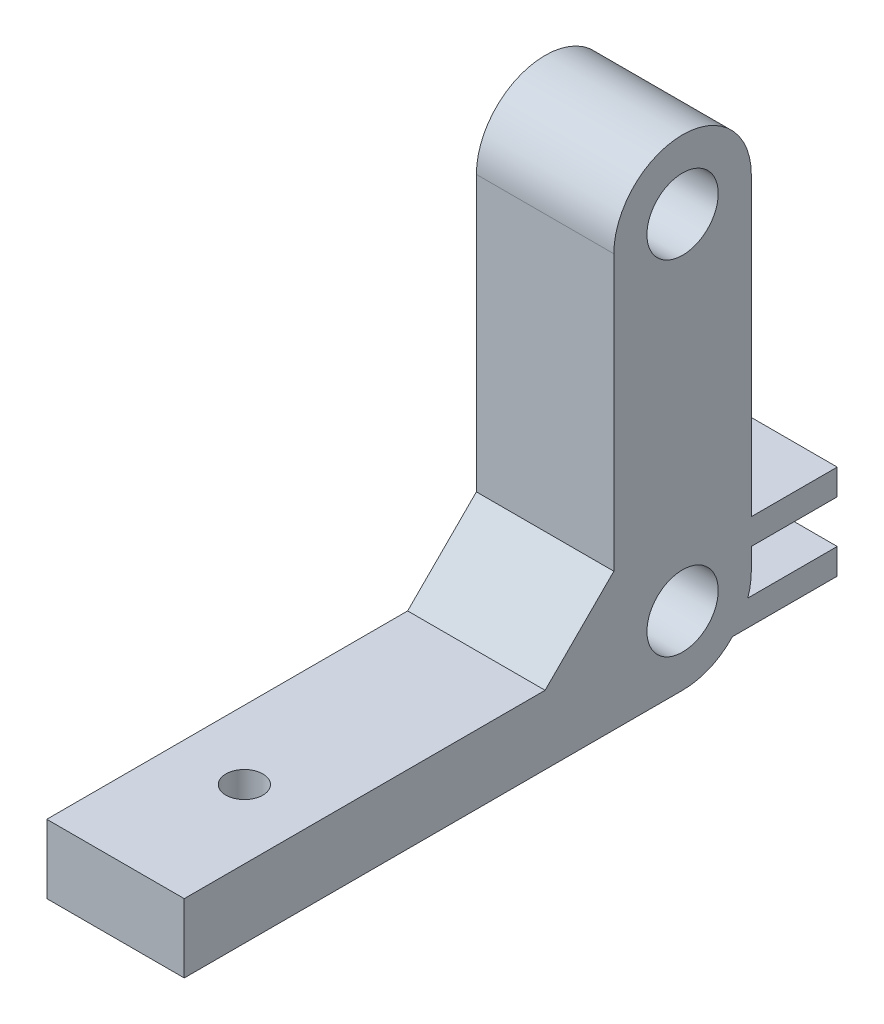
from build123d import *

# Parameters (mm, degrees)
SKETCH1_R           = 4.15
BOSS_EXTRUDE1_DEPTH = 16
SKETCH2_R           = 2.15
CUT_EXTRUDE1_DEPTH  = 78.710493114
SKETCH3_R           = 1.65
CUT_EXTRUDE2_DEPTH  = 75.439040429


with BuildPart() as part:
    # Sketch1 → Boss-Extrude1 (new body)
    with BuildSketch(Plane(origin=(0, 0, 0), x_dir=(0, 0, -1), z_dir=(1, 0, 0))):
        with BuildLine():
            Line((-10.309088451, -58.789851982), (-58.982376521, -58.789851982))
            Line((-58.982376521, -58.789851982), (-58.982376521, -50.789851982))
            Line((-58.982376521, -50.789851982), (-16.982376521, -50.789851982))
            Line((-16.982376521, -50.789851982), (-8.982376521, -42.789851982))
            Line((-8.982376521, -42.789851982), (-8.982376521, -10.789851982))
            ThreePointArc((-8.982376521, -10.789851982), (-0.982376521, -2.789851982), (7.017623479, -10.789851982))
            Line((7.017623479, -10.789851982), (7.017623479, -45.289851982))
            Line((7.017623479, -45.289851982), (17.017623479, -45.289851982))
            Line((17.017623479, -45.289851982), (17.017623479, -48.289851982))
            Line((17.017623479, -48.289851982), (7.017623479, -48.289851982))
            Line((7.017623479, -48.289851982), (7.017623479, -50.789851982))
            ThreePointArc((7.017623479, -50.789851982), (6.916823965, -52.055802887), (6.616965556, -53.289851982))
            Line((6.616965556, -53.289851982), (17.017623479, -53.289851982))
            Line((17.017623479, -53.289851982), (17.017623479, -56.289851982))
            Line((17.017623479, -56.289851982), (4.827098499, -56.289851982))
            ThreePointArc((4.827098499, -56.289851982), (2.179901139, -58.138321211), (-0.982376521, -58.789851982))
            Line((-0.982376521, -58.789851982), (-10.309088451, -58.789851982))
        make_face()
        with Locations((-0.982376521, -10.789851982)):
            Circle(SKETCH1_R, mode=Mode.SUBTRACT)
        with Locations((-0.982376521, -50.789851982)):
            Circle(SKETCH1_R, mode=Mode.SUBTRACT)
    extrude(amount=-BOSS_EXTRUDE1_DEPTH)

    # Sketch2 → Cut-Extrude1 (cut, through all)
    with BuildSketch(Plane(origin=(0, -50.789851982, 0), x_dir=(1, 0, 0), z_dir=(0, 1, 0))):
        with Locations((-8, -43.982376521)):
            Circle(SKETCH2_R)
    extrude(amount=-CUT_EXTRUDE1_DEPTH, mode=Mode.SUBTRACT)

    # Sketch3 → Cut-Extrude2 (cut, through all)
    with BuildSketch(Plane(origin=(0, -45.289851982, 0), x_dir=(1, 0, 0), z_dir=(0, 1, 0))):
        with Locations((-8, 12.017623479)):
            Circle(SKETCH3_R)
    extrude(amount=-CUT_EXTRUDE2_DEPTH, mode=Mode.SUBTRACT)


solid = part.part
